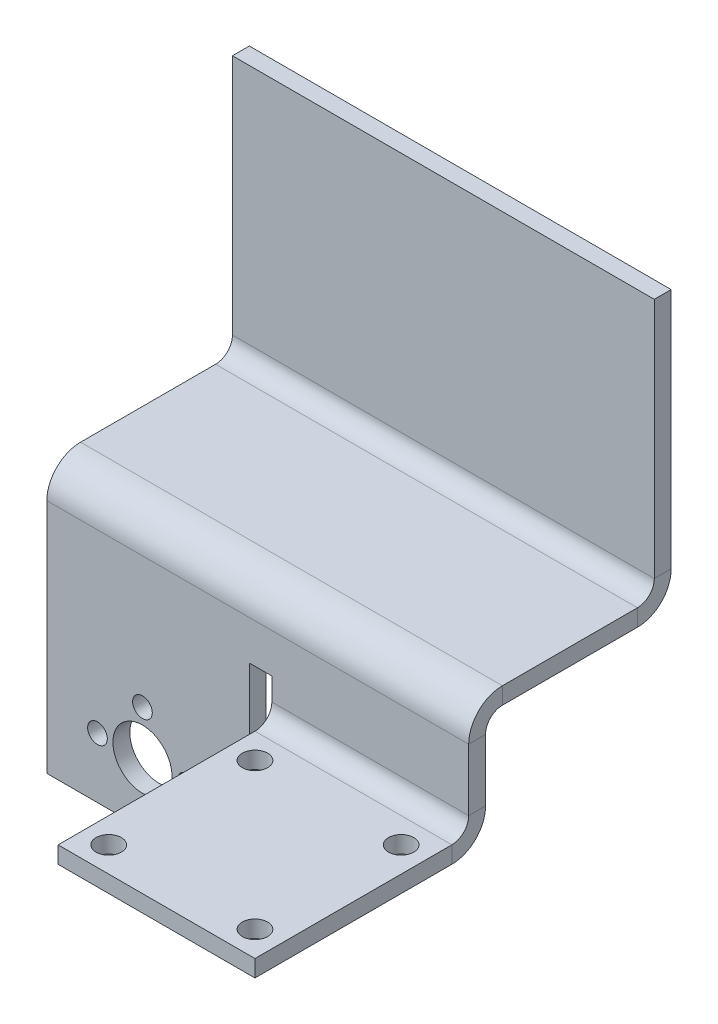
from build123d import *

# Parameters (mm, degrees)
SKETCH1_W                    = 35
SKETCH1_H                    = 35
SKETCH1_R                    = 2.25
BASE_FLANGE1_DEPTH           = 3
EDGE_FLANGE1_DEPTH           = 35
SKETCH9_W                    = 36
SKETCH9_H                    = 35
BOSS_EXTRUDE1_DEPTH          = 3
EDGE_FLANGE2_STRIP_W         = 18
EDGE_FLANGE2_STRIP_H         = 3
EDGE_FLANGE2_STRIP_CUT_DEPTH = 75
EDGE_FLANGE2_DEPTH           = 75
EDGE_FLANGE3_STRIP_W         = 18
EDGE_FLANGE3_STRIP_H         = 3
EDGE_FLANGE3_STRIP_CUT_DEPTH = 75
EDGE_FLANGE3_DEPTH           = 75
SKETCH16_R                   = 5.25
SKETCH16_R_2                 = 1.75
CUT_EXTRUDE1_DEPTH           = 10
BODY_MOVE_COPY1_ANGLE        = 180


# Sheet-metal steps are written as plain solids
with BuildPart() as part:
    # Sketch1 → Base-Flange1 (new body)
    with BuildSketch(Plane.XY):
        Rectangle(SKETCH1_W, SKETCH1_H)
        with Locations((-13, 13)):
            Circle(SKETCH1_R, mode=Mode.SUBTRACT)
        with Locations((13, 13)):
            Circle(SKETCH1_R, mode=Mode.SUBTRACT)
        with Locations((13, -13)):
            Circle(SKETCH1_R, mode=Mode.SUBTRACT)
        with Locations((-13, -13)):
            Circle(SKETCH1_R, mode=Mode.SUBTRACT)
    extrude(amount=-BASE_FLANGE1_DEPTH)

    # Edge-Flange1 section (across the edge) → Edge-Flange1 (add)
    with BuildSketch(Plane(origin=(-17.5, -20.5, 0), x_dir=(0, 1, 0), z_dir=(1, 0, 0))):
        with BuildLine():
            Line((-3, 3), (-3, 17))
            Line((-3, 17), (0, 17))
            Line((0, 17), (0, 3))
            ThreePointArc((0, 3), (0.878679656, 0.878679656), (3, 0))
            Line((3, 0), (3, -3))
            ThreePointArc((3, -3), (-1.242640687, -1.242640687), (-3, 3))
        make_face()
    extrude(amount=EDGE_FLANGE1_DEPTH)

    # Sketch9 → Boss-Extrude1 (add)
    with BuildSketch(Plane.XZ.offset(23.5)):
        Polygon((57.5, 17), (17.5, 17), (17.5, 7), (21.5, 7), (57.5, 7), align=None)
        with Locations((39.5, -10.5)):
            Rectangle(SKETCH9_W, SKETCH9_H)
    extrude(amount=-BOSS_EXTRUDE1_DEPTH)

    # Edge-Flange2 strip (across the edge) → Edge-Flange2 strip cut (cut)
    with BuildSketch(Plane(origin=(57.5, -23.5, 17), x_dir=(0, 0, -1), z_dir=(-1, 0, 0))):
        with Locations((-6, -1.5)):
            Rectangle(EDGE_FLANGE2_STRIP_W, EDGE_FLANGE2_STRIP_H)
    extrude(amount=EDGE_FLANGE2_STRIP_CUT_DEPTH, mode=Mode.SUBTRACT)

    # Edge-Flange2 section (across the edge) → Edge-Flange2 (add)
    with BuildSketch(Plane(origin=(57.5, -23.5, 17), x_dir=(0, 0, -1), z_dir=(-1, 0, 0))):
        with BuildLine():
            Line((-3, 3), (-3, 30))
            Line((-3, 30), (0, 30))
            Line((0, 30), (0, 3))
            ThreePointArc((0, 3), (0.878679656, 0.878679656), (3, 0))
            Line((3, 0), (3, -3))
            ThreePointArc((3, -3), (-1.242640687, -1.242640687), (-3, 3))
        make_face()
    extrude(amount=EDGE_FLANGE2_DEPTH)

    # Edge-Flange3 strip (across the edge) → Edge-Flange3 strip cut (cut)
    with BuildSketch(Plane(origin=(-17.5, -53.5, 20), x_dir=(0, 1, 0), z_dir=(1, 0, 0))):
        with Locations((-6, -1.5)):
            Rectangle(EDGE_FLANGE3_STRIP_W, EDGE_FLANGE3_STRIP_H)
    extrude(amount=EDGE_FLANGE3_STRIP_CUT_DEPTH, mode=Mode.SUBTRACT)

    # Edge-Flange3 section (across the edge) → Edge-Flange3 (add)
    with BuildSketch(Plane(origin=(-17.5, -53.5, 20), x_dir=(0, 1, 0), z_dir=(1, 0, 0))):
        with BuildLine():
            Line((-3, 3), (-3, 46))
            Line((-3, 46), (0, 46))
            Line((0, 46), (0, 3))
            ThreePointArc((0, 3), (0.878679656, 0.878679656), (3, 0))
            Line((3, 0), (3, -3))
            ThreePointArc((3, -3), (-1.242640687, -1.242640687), (-3, 3))
        make_face()
    extrude(amount=EDGE_FLANGE3_DEPTH)

    # Sketch16 → Cut-Extrude1 (cut)
    with BuildSketch(Plane(origin=(0, -20.5, 0), x_dir=(1, 0, 0), z_dir=(0, 1, 0))):
        with Locations(Location((40.5, 17.3, 0), (0, 0, 270))):
            Circle(SKETCH16_R)
        with Locations(Location((40.5, 9.3, 0), (0, 0, 270))):
            Circle(SKETCH16_R_2)
        with Locations(Location((48.5, 17.3, 0), (0, 0, 270))):
            Circle(SKETCH16_R_2)
        with Locations(Location((32.5, 17.3, 0), (0, 0, 270))):
            Circle(SKETCH16_R_2)
    extrude(amount=-CUT_EXTRUDE1_DEPTH, mode=Mode.SUBTRACT)


with BuildPart() as part_1:
    # Body-Move/Copy1: moved
    add(part.part.moved(Location((0, 0, 0))).rotate(Axis((20, -19.25, 19.25), (-4.937700262163626e-15, 0.7071067811864181, 0.707106781186677)), BODY_MOVE_COPY1_ANGLE))


solid = part_1.part
